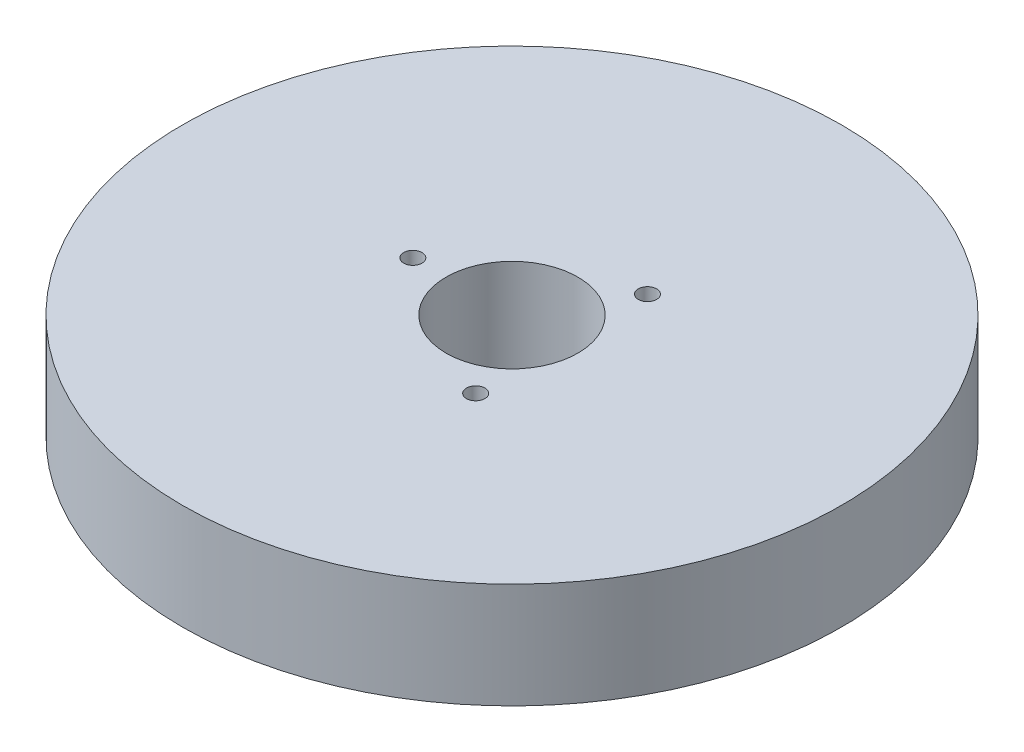
from build123d import *

# Parameters (mm, degrees)
SKETCH1_R           = 75
BOSS_EXTRUDE1_DEPTH = 24
SKETCH2_R           = 15
CUT_EXTRUDE1_DEPTH  = 109.747413762
SKETCH3_R           = 2.093413073
CUT_EXTRUDE2_DEPTH  = 22.421886393
CIRPATTERN1_COUNT   = 3


with BuildPart() as part:
    # Sketch1 → Boss-Extrude1 (new body)
    with BuildSketch(Plane(origin=(0, 0, 0), x_dir=(1, 0, 0), z_dir=(0, 1, 0))):
        Circle(SKETCH1_R)
    extrude(amount=BOSS_EXTRUDE1_DEPTH)

    # Sketch2 → Cut-Extrude1 (cut, through all)
    with BuildSketch(Plane(origin=(0, 0, 0), x_dir=(1, 0, 0), z_dir=(0, 1, 0))):
        Circle(SKETCH2_R)
    extrude(amount=CUT_EXTRUDE1_DEPTH, mode=Mode.SUBTRACT)

    # Sketch3 → Cut-Extrude2 (cut)
    with BuildSketch(Plane(origin=(0, 24, 0), x_dir=(1, 0, 0), z_dir=(0, 1, 0))):
        with Locations((-22.566281903, 0)):
            Circle(SKETCH3_R)
    cut_extrude2 = extrude(amount=-CUT_EXTRUDE2_DEPTH, mode=Mode.SUBTRACT)

    # CirPattern1: Cut-Extrude2 ×3 about axis
    cirpattern1_axis = Axis((0, 0, 0), (0, 1, 0))
    for i in range(1, CIRPATTERN1_COUNT):
        add(cut_extrude2.rotate(cirpattern1_axis, i * 360 / CIRPATTERN1_COUNT), mode=Mode.SUBTRACT)


solid = part.part
